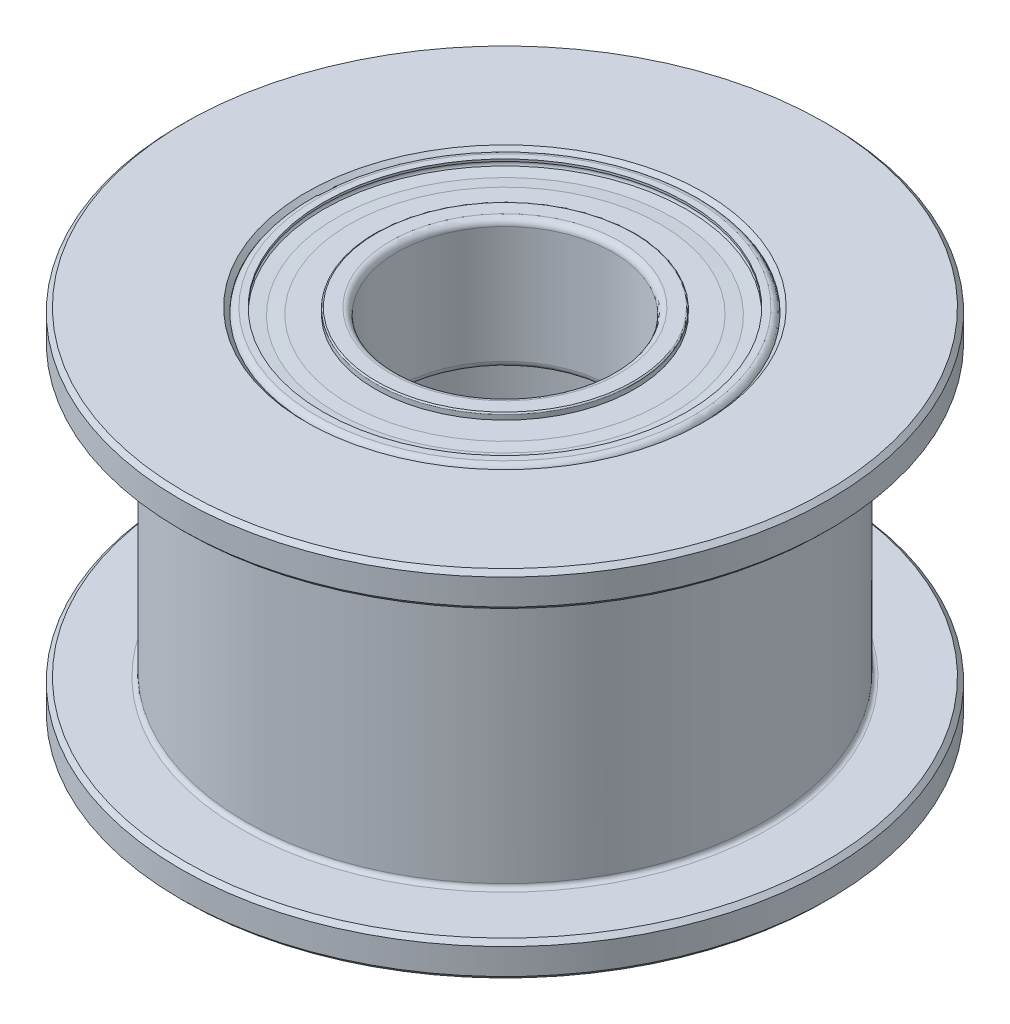
from build123d import *

# Parameters (mm, degrees)
ZKOSEN_1_SIZE      = 0.1
ZAOBLIT1_R         = 0.1
KRUHOV_POLE1_COUNT = 8
KRUHOV_POLE3_COUNT = 8


with BuildPart() as part:
    # Skica1 → Rotovat1 (revolve)
    with BuildSketch(Plane.XY):
        Polygon((4.5, 8.2), (7.5, 8.2), (7.5, 7.4), (6, 7.4), (6, 0.8), (7.5, 0.8), (7.5, 0), (4.5, 0), (4.5, 3), (3.5, 3), (3.5, 5.2), (4.5, 5.2), align=None)
    revolve(axis=Axis((0, 0, 0), (0, -1, 0)))

    # Zkosení1
    zkosen_1_edges = [part.edges().sort_by_distance(p)[0] for p in [
        (-3.5, 3, 0),
        (-4.5, 0, 0),
        (-3.5, 5.2, 0),
        (-7.5, 0, 0),
        (-7.5, 0.8, 0),
        (-7.5, 7.4, 0),
        (-7.5, 8.2, 0),
        (-4.5, 8.2, 0),
    ]]
    chamfer(zkosen_1_edges, length=ZKOSEN_1_SIZE)

    # Zaoblit1
    zaoblit1_edges = [part.edges().sort_by_distance(p)[0] for p in [
        (-4.5, 3, 0),
        (-6, 0.8, 0),
        (-6, 7.4, 0),
        (-4.5, 5.2, 0),
    ]]
    fillet(zaoblit1_edges, radius=ZAOBLIT1_R)


with BuildPart() as body_2:
    # Skica4 → Rotovat2 (revolve)
    with BuildSketch(Plane.XY):
        with BuildLine():
            Line((4.5, 8.05), (4.5, 5.35))
            ThreePointArc((4.5, 5.35), (4.456066017, 5.243933983), (4.35, 5.2))
            Line((4.35, 5.2), (4.2, 5.2))
            Line((4.2, 5.2), (4.2, 5.25))
            ThreePointArc((4.2, 5.25), (4.289757174, 5.333393211), (4.213177928, 5.429030007))
            Line((4.213177928, 5.429030007), (3.85, 5.482786405))
            Line((3.85, 5.482786405), (3.85, 6.252786405))
            ThreePointArc((3.85, 6.252786405), (4.05, 6.7), (3.85, 7.147213595))
            Line((3.85, 7.147213595), (3.85, 7.917213595))
            Line((3.85, 7.917213595), (4.213177928, 7.970969993))
            ThreePointArc((4.213177928, 7.970969993), (4.289757174, 8.066606789), (4.2, 8.15))
            Line((4.2, 8.15), (4.2, 8.2))
            Line((4.2, 8.2), (4.35, 8.2))
            ThreePointArc((4.35, 8.2), (4.456066017, 8.156066017), (4.5, 8.05))
        make_face()
    revolve(axis=Axis((0, 0, 0), (0, 1, 0)))


with BuildPart() as body_3:
    # Skica5 → Rotovat3 (revolve)
    with BuildSketch(Plane.XY):
        with BuildLine():
            Line((2.5, 8.05), (2.5, 5.35))
            ThreePointArc((2.5, 5.35), (2.543933983, 5.243933983), (2.65, 5.2))
            Line((2.65, 5.2), (2.97, 5.2))
            ThreePointArc((2.97, 5.2), (2.991213203, 5.208786797), (3, 5.23))
            Line((3, 5.23), (3, 5.34))
            Line((3, 5.34), (3.6, 5.34))
            Line((3.6, 5.34), (3.896185034, 5.391714847))
            Line((3.896185034, 5.391714847), (4.192370069, 5.34))
            Line((4.192370069, 5.34), (4.192370069, 5.39))
            Line((4.192370069, 5.39), (3.897467562, 5.458062558))
            Line((3.897467562, 5.458062558), (3.597467562, 5.458062558))
            Line((3.597467562, 5.458062558), (3, 5.39))
            Line((3, 5.39), (3, 6.303137303))
            ThreePointArc((3, 6.303137303), (2.85, 6.7), (3, 7.096862697))
            Line((3, 7.096862697), (3, 8.01))
            Line((3, 8.01), (3.6, 7.97))
            Line((3.6, 7.97), (3.9, 7.97))
            Line((3.9, 7.97), (4.2, 8.01))
            Line((4.2, 8.01), (4.2, 8.06))
            Line((4.2, 8.06), (3.9, 8.04))
            Line((3.9, 8.04), (3.6, 8.06))
            Line((3.6, 8.06), (3, 8.06))
            Line((3, 8.06), (3, 8.17))
            ThreePointArc((3, 8.17), (2.991213203, 8.191213203), (2.97, 8.2))
            Line((2.97, 8.2), (2.65, 8.2))
            ThreePointArc((2.65, 8.2), (2.543933983, 8.156066017), (2.5, 8.05))
        make_face()
    revolve(axis=Axis((0, 0, 0), (0, 1, 0)))


with BuildPart() as body_4:
    # Skica6 → Rotovat4 (revolve)
    with BuildSketch(Plane.XY):
        with BuildLine():
            Line((3.45, 7.3), (3.45, 6.1))
            ThreePointArc((3.45, 6.1), (4.05, 6.7), (3.45, 7.3))
        make_face()
    revolve(axis=Axis((3.45, 7.3, 0), (0, -1, 0)))


with BuildPart() as kruhov_pole1_1:
    # Kruhové pole1: pattern copy
    add(body_4.part.rotate(Axis((0, 0, 0), (0, 1, 0)), 1 * 360 / KRUHOV_POLE1_COUNT))


with BuildPart() as kruhov_pole1_2:
    # Kruhové pole1: pattern copy
    add(body_4.part.rotate(Axis((0, 0, 0), (0, 1, 0)), 2 * 360 / KRUHOV_POLE1_COUNT))


with BuildPart() as kruhov_pole1_3:
    # Kruhové pole1: pattern copy
    add(body_4.part.rotate(Axis((0, 0, 0), (0, 1, 0)), 3 * 360 / KRUHOV_POLE1_COUNT))


with BuildPart() as kruhov_pole1_4:
    # Kruhové pole1: pattern copy
    add(body_4.part.rotate(Axis((0, 0, 0), (0, 1, 0)), 4 * 360 / KRUHOV_POLE1_COUNT))


with BuildPart() as kruhov_pole1_5:
    # Kruhové pole1: pattern copy
    add(body_4.part.rotate(Axis((0, 0, 0), (0, 1, 0)), 5 * 360 / KRUHOV_POLE1_COUNT))


with BuildPart() as kruhov_pole1_6:
    # Kruhové pole1: pattern copy
    add(body_4.part.rotate(Axis((0, 0, 0), (0, 1, 0)), 6 * 360 / KRUHOV_POLE1_COUNT))


with BuildPart() as kruhov_pole1_7:
    # Kruhové pole1: pattern copy
    add(body_4.part.rotate(Axis((0, 0, 0), (0, 1, 0)), 7 * 360 / KRUHOV_POLE1_COUNT))


with BuildPart() as body_12:
    # Skica7 → Rotovat5 (revolve)
    with BuildSketch(Plane.XY):
        with BuildLine():
            Line((4.5, 2.85), (4.5, 0.15))
            ThreePointArc((4.5, 0.15), (4.456066017, 0.043933983), (4.35, 0))
            Line((4.35, 0), (4.2, 0))
            Line((4.2, 0), (4.2, 0.05))
            ThreePointArc((4.2, 0.05), (4.289757174, 0.133393211), (4.213177928, 0.229030007))
            Line((4.213177928, 0.229030007), (3.85, 0.282786405))
            Line((3.85, 0.282786405), (3.85, 1.052786405))
            ThreePointArc((3.85, 1.052786405), (4.05, 1.5), (3.85, 1.947213595))
            Line((3.85, 1.947213595), (3.85, 2.717213595))
            Line((3.85, 2.717213595), (4.213177928, 2.770969993))
            ThreePointArc((4.213177928, 2.770969993), (4.289757174, 2.866606789), (4.2, 2.95))
            Line((4.2, 2.95), (4.2, 3))
            Line((4.2, 3), (4.35, 3))
            ThreePointArc((4.35, 3), (4.456066017, 2.956066017), (4.5, 2.85))
        make_face()
    revolve(axis=Axis((0, 0, 0), (0, 1, 0)))


with BuildPart() as body_13:
    # Skica8 → Rotovat6 (revolve)
    with BuildSketch(Plane.XY):
        with BuildLine():
            Line((2.5, 2.85), (2.5, 0.15))
            ThreePointArc((2.5, 0.15), (2.543933983, 0.043933983), (2.65, 0))
            Line((2.65, 0), (2.97, 0))
            ThreePointArc((2.97, 0), (2.991213203, 0.008786797), (3, 0.03))
            Line((3, 0.03), (3, 0.14))
            Line((3, 0.14), (3.6, 0.14))
            Line((3.6, 0.14), (3.896185034, 0.191714847))
            Line((3.896185034, 0.191714847), (4.192370069, 0.14))
            Line((4.192370069, 0.14), (4.192370069, 0.19))
            Line((4.192370069, 0.19), (3.897467562, 0.258062558))
            Line((3.897467562, 0.258062558), (3.597467562, 0.258062558))
            Line((3.597467562, 0.258062558), (3, 0.19))
            Line((3, 0.19), (3, 1.103137303))
            ThreePointArc((3, 1.103137303), (2.85, 1.5), (3, 1.896862697))
            Line((3, 1.896862697), (3, 2.81))
            Line((3, 2.81), (3.6, 2.77))
            Line((3.6, 2.77), (3.9, 2.77))
            Line((3.9, 2.77), (4.2, 2.81))
            Line((4.2, 2.81), (4.2, 2.86))
            Line((4.2, 2.86), (3.9, 2.84))
            Line((3.9, 2.84), (3.6, 2.86))
            Line((3.6, 2.86), (3, 2.86))
            Line((3, 2.86), (3, 2.97))
            ThreePointArc((3, 2.97), (2.991213203, 2.991213203), (2.97, 3))
            Line((2.97, 3), (2.65, 3))
            ThreePointArc((2.65, 3), (2.543933983, 2.956066017), (2.5, 2.85))
        make_face()
    revolve(axis=Axis((0, 0, 0), (0, -1, 0)))


with BuildPart() as body_14:
    # Skica9 → Rotovat7 (revolve)
    with BuildSketch(Plane.XY):
        with BuildLine():
            Line((3.45, 2.1), (3.45, 0.9))
            ThreePointArc((3.45, 0.9), (4.05, 1.5), (3.45, 2.1))
        make_face()
    revolve(axis=Axis((3.45, 2.1, 0), (0, -1, 0)))


with BuildPart() as kruhov_pole3_1:
    # Kruhové pole3: pattern copy
    add(body_14.part.rotate(Axis((0, 0, 0), (0, 1, 0)), 1 * 360 / KRUHOV_POLE3_COUNT))


with BuildPart() as kruhov_pole3_2:
    # Kruhové pole3: pattern copy
    add(body_14.part.rotate(Axis((0, 0, 0), (0, 1, 0)), 2 * 360 / KRUHOV_POLE3_COUNT))


with BuildPart() as kruhov_pole3_3:
    # Kruhové pole3: pattern copy
    add(body_14.part.rotate(Axis((0, 0, 0), (0, 1, 0)), 3 * 360 / KRUHOV_POLE3_COUNT))


with BuildPart() as kruhov_pole3_4:
    # Kruhové pole3: pattern copy
    add(body_14.part.rotate(Axis((0, 0, 0), (0, 1, 0)), 4 * 360 / KRUHOV_POLE3_COUNT))


with BuildPart() as kruhov_pole3_5:
    # Kruhové pole3: pattern copy
    add(body_14.part.rotate(Axis((0, 0, 0), (0, 1, 0)), 5 * 360 / KRUHOV_POLE3_COUNT))


with BuildPart() as kruhov_pole3_6:
    # Kruhové pole3: pattern copy
    add(body_14.part.rotate(Axis((0, 0, 0), (0, 1, 0)), 6 * 360 / KRUHOV_POLE3_COUNT))


with BuildPart() as kruhov_pole3_7:
    # Kruhové pole3: pattern copy
    add(body_14.part.rotate(Axis((0, 0, 0), (0, 1, 0)), 7 * 360 / KRUHOV_POLE3_COUNT))


solid = Compound([part.part, body_2.part, body_3.part, body_4.part, kruhov_pole1_1.part, kruhov_pole1_2.part, kruhov_pole1_3.part, kruhov_pole1_4.part, kruhov_pole1_5.part, kruhov_pole1_6.part, kruhov_pole1_7.part, body_12.part, body_13.part, body_14.part, kruhov_pole3_1.part, kruhov_pole3_2.part, kruhov_pole3_3.part, kruhov_pole3_4.part, kruhov_pole3_5.part, kruhov_pole3_6.part, kruhov_pole3_7.part])
